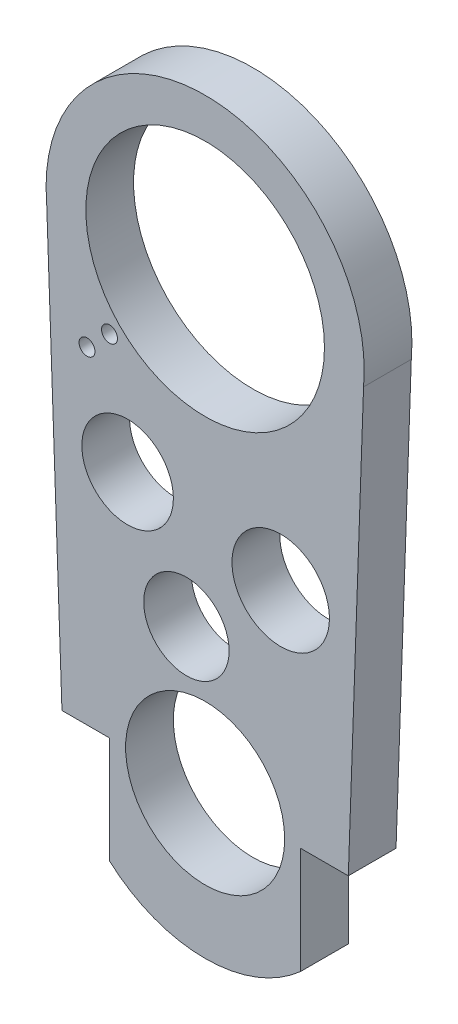
from build123d import *

# Parameters (mm, degrees)
ESQUISSE1_R        = 5
ESQUISSE1_R_2      = 2.877506478
ESQUISSE1_R_3      = 3.063484505
ESQUISSE1_R_4      = 2.684325632
ESQUISSE1_R_5      = 0.5
ESQUISSE1_R_6      = 7.5
BOSS_EXTRU_1_DEPTH = 3


with BuildPart() as part:
    # Esquisse1 → Boss.-Extru.1 (new body)
    with BuildSketch(Plane.XY):
        with BuildLine():
            Line((6, -6.708203932), (6, 0))
            Line((6, 0), (9, 0))
            Line((9, 0), (9.959071707, 27.096179922))
            ThreePointArc((9.959071707, 27.096179922), (0, 38), (-9.959071707, 27.096179922))
            Line((-9.959071707, 27.096179922), (-9, 0))
            Line((-9, 0), (-6, 0))
            Line((-6, 0), (-6, -6.708203932))
            ThreePointArc((-6, -6.708203932), (0, -9), (6, -6.708203932))
        make_face()
        Circle(ESQUISSE1_R, mode=Mode.SUBTRACT)
        with Locations((-4.874230419, 15.048067775)):
            Circle(ESQUISSE1_R_2, mode=Mode.SUBTRACT)
        with Locations((4.750736526, 13.416152965)):
            Circle(ESQUISSE1_R_3, mode=Mode.SUBTRACT)
        with Locations((-1.177443807, 8.487104148)):
            Circle(ESQUISSE1_R_4, mode=Mode.SUBTRACT)
        with Locations((-7.424621202, 20.575378798)):
            Circle(ESQUISSE1_R_5, mode=Mode.SUBTRACT)
        with Locations((-6.01040764, 21.98959236)):
            Circle(ESQUISSE1_R_5, mode=Mode.SUBTRACT)
        with Locations((0, 28)):
            Circle(ESQUISSE1_R_6, mode=Mode.SUBTRACT)
    extrude(amount=BOSS_EXTRU_1_DEPTH)


solid = part.part
